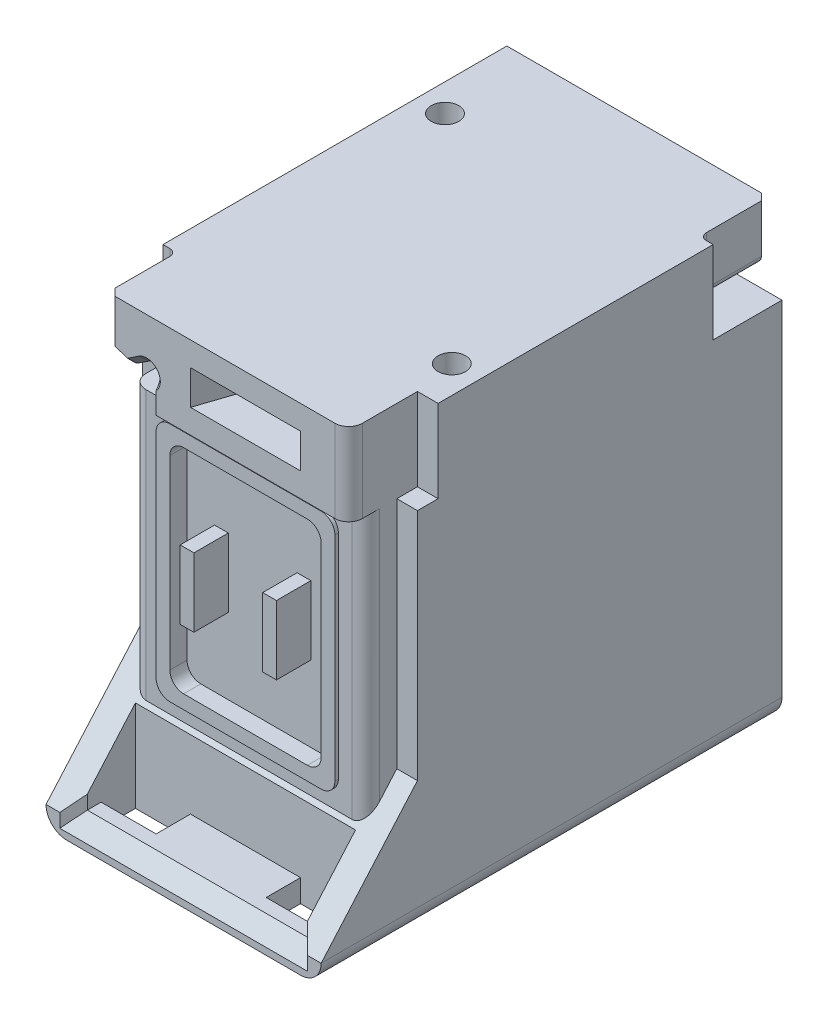
from build123d import *

# Parameters (mm, degrees)
SKETCH1_W           = 10.16
SKETCH1_H           = 16.51
BOSS_EXTRUDE1_DEPTH = 12.7
BOSS_EXTRUDE2_DEPTH = 10.16
SKETCH3_W           = 1.27
SKETCH3_H           = 3.048
CUT_EXTRUDE1_DEPTH  = 1.524
CUT_EXTRUDE2_DEPTH  = 2.54
SKETCH6_W           = 2.032
SKETCH6_H           = 1.27
CUT_EXTRUDE5_DEPTH  = 24.17532524
SKETCH8_W           = 8.128
SKETCH8_H           = 2.032
CUT_EXTRUDE6_DEPTH  = 2.54
CUT_EXTRUDE7_DEPTH  = 8.128
CUT_EXTRUDE8_START  = -1.778
SKETCH10_W          = 8.128
SKETCH10_H          = 0.508
CUT_EXTRUDE8_DEPTH  = 1.778
CUT_EXTRUDE9_DEPTH  = 1.778
BOSS_EXTRUDE3_REACH = 23.113
SKETCH12_W          = 8.636
SKETCH12_H          = 1.143
CUT_EXTRUDE10_DEPTH = 0.508
BOSS_EXTRUDE4_START = 0.127
BOSS_EXTRUDE4_DEPTH = 0.127
SKETCH16_W          = 0.508
SKETCH16_H          = 2.54
BOSS_EXTRUDE5_DEPTH = 1.27
SKETCH18_W          = 7.112
SKETCH18_H          = 3.048
BOSS_EXTRUDE6_DEPTH = 2.54
SKETCH19_W          = 3.048
SKETCH19_H          = 1.27
CUT_EXTRUDE11_DEPTH = 1.524
CUT_EXTRUDE12_DEPTH = 1.524
SKETCH22_R          = 0.508
CUT_EXTRUDE13_DEPTH = 0.762
BOSS_EXTRUDE8_DEPTH = 2.54
FILLET1_R           = 0.762
FILLET2_R           = 0.508
FILLET3_R           = 0.508
FILLET4_R           = 0.254
CHAMFER2_SIZE       = 0.254
FILLET5_R           = 0.254
CHAMFER3_SIZE       = 0.254
FILLET6_R           = 0.254
FILLET8_R           = 0.254


# Some blends are built 0.0001 mm under size
with BuildPart() as part:
    # Sketch1 → Boss-Extrude1 (new body)
    with BuildSketch(Plane.XY):
        with Locations((5.08, 8.255)):
            Rectangle(SKETCH1_W, SKETCH1_H)
    extrude(amount=-BOSS_EXTRUDE1_DEPTH)

    # Sketch2 → Boss-Extrude2 (add)
    with BuildSketch(Plane.ZY):
        Polygon((0, 13.462), (0.762, 13.462), (0.762, 4.826), (4.318, 0.762), (4.318, 0), (0, 0), align=None)
    extrude(amount=-BOSS_EXTRUDE2_DEPTH)

    # Sketch3 → Cut-Extrude1 (cut)
    with BuildSketch(Plane(origin=(0, 0, -12.7), x_dir=(-1, 0, 0), z_dir=(0, 0, -1))):
        with Locations((-1.651, 5.588)):
            Rectangle(SKETCH3_W, SKETCH3_H)
    extrude(amount=-CUT_EXTRUDE1_DEPTH, mode=Mode.SUBTRACT)

    # Sketch4 → Cut-Extrude2 (cut)
    with BuildSketch(Plane(origin=(0, 0, -12.7), x_dir=(-1, 0, 0), z_dir=(0, 0, -1))):
        with BuildLine():
            Line((-10.16, 13.462), (-7.874, 13.462))
            Line((-7.874, 13.462), (-7.874, 14.732))
            ThreePointArc((-7.874, 14.732), (-8.111909378, 14.806021803), (-8.356399754, 14.758016014))
            Line((-8.356399754, 14.758016014), (-9.045285349, 14.432315787))
            ThreePointArc((-9.045285349, 14.432315787), (-9.133273497, 14.40877931), (-9.223907772, 14.41779641))
            Line((-9.223907772, 14.41779641), (-9.468055681, 14.487852091))
            ThreePointArc((-9.468055681, 14.487852091), (-9.600867128, 14.579157177), (-9.652, 14.732))
            Line((-9.652, 14.732), (-9.652, 16.51))
            Line((-9.652, 16.51), (-10.16, 16.51))
            Line((-10.16, 16.51), (-10.16, 13.462))
        make_face()
    extrude(amount=-CUT_EXTRUDE2_DEPTH, mode=Mode.SUBTRACT)

    # Sketch6 → Cut-Extrude5 (cut, through all)
    with BuildSketch(Plane(origin=(0, 0, 0), x_dir=(-1, 0, 0), z_dir=(0, -1, 0))):
        with Locations((-2.032, -2.667)):
            Rectangle(SKETCH6_W, SKETCH6_H)
        with Locations((-8.128, -2.667)):
            Rectangle(SKETCH6_W, SKETCH6_H)
    extrude(amount=-CUT_EXTRUDE5_DEPTH, mode=Mode.SUBTRACT)

    # Sketch8 → Cut-Extrude6 (cut)
    with BuildSketch(Plane.XY.offset(2.032)):
        with Locations((5.08, 2.358571429)):
            Rectangle(SKETCH8_W, SKETCH8_H)
    extrude(amount=CUT_EXTRUDE6_DEPTH, mode=Mode.SUBTRACT)

    # 3DSketch3 → Cut-Extrude7 (cut, along a direction that is not the sketch's normal)
    with BuildSketch(Plane(origin=(0.508, 0.762, 4.318), x_dir=(0.5499719409228688, 0.6285393610547091, -0.5499719409228716), z_dir=(-0.7071067811865493, 0, -0.7071067811865457))):
        Polygon((0, 0), (-0.319297995, 0.395111111), (0.604385491, 0.395111111), (0.923683487, 0), align=None)
    extrude(amount=-CUT_EXTRUDE7_DEPTH, dir=(-1, 0, 0), mode=Mode.SUBTRACT)

    # Sketch10 → Cut-Extrude8 (cut)
    with BuildSketch(Plane.XY.offset(3.81).offset(CUT_EXTRUDE8_START)):
        with Locations((5.08, 1.088571429)):
            Rectangle(SKETCH10_W, SKETCH10_H)
    extrude(amount=CUT_EXTRUDE8_DEPTH, mode=Mode.SUBTRACT)

    # 3DSketch6 → Cut-Extrude9 (cut, along a direction that is not the sketch's normal)
    with BuildSketch(Plane(origin=(9.652, 0.762, 4.318), x_dir=(-0.5499719409228674, 0.6285393610547109, -0.5499719409228712), z_dir=(-0.7071067811865499, 0, 0.7071067811865451))):
        Polygon((0, 0), (0.923683487, 0), (0.604385491, 0.395111111), (-0.319297995, 0.395111111), align=None)
    extrude(amount=CUT_EXTRUDE9_DEPTH, dir=(-1, 0, 0), mode=Mode.SUBTRACT)

    # Boss-Extrude3: up to this plane
    boss_extrude3_end = Plane(origin=(10.16, 0.762, 4.318), z_dir=(0, 0.6585046078685179, 0.752576694706878))
    # Sketch12 → Boss-Extrude3 (add, up to the surface)
    with BuildSketch(Plane(origin=(0, 13.462, 0), x_dir=(1, 0, 0), z_dir=(0, 1, 0)), mode=Mode.PRIVATE) as boss_extrude3_sk1:
        with Locations((5.08, -1.3335)):
            Rectangle(SKETCH12_W, SKETCH12_H)
    boss_extrude3_tool1 = split(extrude(boss_extrude3_sk1.sketch, amount=-BOSS_EXTRUDE3_REACH, mode=Mode.PRIVATE), bisect_by=boss_extrude3_end, keep=Keep.BOTH, mode=Mode.PRIVATE)
    add(boss_extrude3_tool1.solids().sort_by_distance((5.08, 13.462, 1.3335))[0])

    # Sketch13 → Cut-Extrude10 (cut)
    with BuildSketch(Plane.XY.offset(1.905)):
        with BuildLine():
            Line((2.794, 12.427857143), (7.366, 12.427857143))
            ThreePointArc((7.366, 12.427857143), (7.725210245, 12.279067388), (7.874, 11.919857143))
            Line((7.874, 11.919857143), (7.874, 5.061857143))
            ThreePointArc((7.874, 5.061857143), (7.725210245, 4.702646898), (7.366, 4.553857143))
            Line((7.366, 4.553857143), (2.794, 4.553857143))
            ThreePointArc((2.794, 4.553857143), (2.434789755, 4.702646898), (2.286, 5.061857143))
            Line((2.286, 5.061857143), (2.286, 11.919857143))
            ThreePointArc((2.286, 11.919857143), (2.434789755, 12.279067388), (2.794, 12.427857143))
        make_face()
    extrude(amount=-CUT_EXTRUDE10_DEPTH, mode=Mode.SUBTRACT)

    # Sketch14 → Boss-Extrude4 (add)
    with BuildSketch(Plane.XY.offset(1.905).offset(BOSS_EXTRUDE4_START)):
        with BuildLine():
            Line((2.286, 4.045857143), (7.874, 4.045857143))
            ThreePointArc((7.874, 4.045857143), (8.233210245, 4.194646898), (8.382, 4.553857143))
            Line((8.382, 4.553857143), (8.382, 12.427857143))
            ThreePointArc((8.382, 12.427857143), (8.233210245, 12.787067388), (7.874, 12.935857143))
            Line((7.874, 12.935857143), (2.286, 12.935857143))
            ThreePointArc((2.286, 12.935857143), (1.926789755, 12.787067388), (1.778, 12.427857143))
            Line((1.778, 12.427857143), (1.778, 4.553857143))
            ThreePointArc((1.778, 4.553857143), (1.926789755, 4.194646898), (2.286, 4.045857143))
        make_face()
        with BuildLine():
            Line((2.794, 12.427857143), (7.366, 12.427857143))
            ThreePointArc((7.366, 12.427857143), (7.725210245, 12.279067388), (7.874, 11.919857143))
            Line((7.874, 11.919857143), (7.874, 5.061857143))
            ThreePointArc((7.874, 5.061857143), (7.725210245, 4.702646898), (7.366, 4.553857143))
            Line((7.366, 4.553857143), (2.794, 4.553857143))
            ThreePointArc((2.794, 4.553857143), (2.434789755, 4.702646898), (2.286, 5.061857143))
            Line((2.286, 5.061857143), (2.286, 11.919857143))
            ThreePointArc((2.286, 11.919857143), (2.434789755, 12.279067388), (2.794, 12.427857143))
        make_face(mode=Mode.SUBTRACT)
    extrude(amount=-BOSS_EXTRUDE4_DEPTH)

    # Sketch16 → Boss-Extrude5 (add)
    with BuildSketch(Plane.XY.offset(1.397)):
        with Locations((3.556, 8.617857143)):
            Rectangle(SKETCH16_W, SKETCH16_H)
        with Locations((6.604, 8.617857143)):
            Rectangle(SKETCH16_W, SKETCH16_H)
    extrude(amount=BOSS_EXTRUDE5_DEPTH)

    # Sketch18 → Boss-Extrude6 (add)
    with BuildSketch(Plane.XY):
        with Locations((5.842, 14.986)):
            Rectangle(SKETCH18_W, SKETCH18_H)
    extrude(amount=BOSS_EXTRUDE6_DEPTH)

    # Sketch19 → Cut-Extrude11 (cut)
    with BuildSketch(Plane.XY.offset(2.54)):
        with Locations((5.588, 14.986)):
            Rectangle(SKETCH19_W, SKETCH19_H)
    extrude(amount=-CUT_EXTRUDE11_DEPTH, mode=Mode.SUBTRACT)

    # 3DSketch8 → Cut-Extrude12 (cut, along a direction that is not the sketch's normal)
    with BuildSketch(Plane(origin=(4.064, 15.621, 1.016), x_dir=(-0.24806946917841682, -0.6201736729460425, 0.7442084075352507), z_dir=(-0.9486832980505139, 0, -0.31622776601683783))):
        Polygon((0, 0), (1.260192903, 0.996269967), (2.047813468, 0), (0.787620565, -0.996269967), align=None)
    cut_extrude12 = extrude(amount=-CUT_EXTRUDE12_DEPTH, dir=(-1, 0, 0), mode=Mode.SUBTRACT)

    # Mirror1: Cut-Extrude12 across plane
    add(cut_extrude12.mirror(Plane(origin=(5.588, 0, 0), x_dir=(0, 0, 1), z_dir=(1, 0, 0))), mode=Mode.SUBTRACT)

    # Sketch22 → Cut-Extrude13 (cut)
    with BuildSketch(Plane(origin=(0, 16.51, 0), x_dir=(1, 0, 0), z_dir=(0, 1, 0))):
        with Locations(Location((9.144, 1.524, 0), (0, 0, 270))):
            Circle(SKETCH22_R)
        with Locations(Location((1.016, 9.398, 0), (0, 0, 270))):
            Circle(SKETCH22_R)
    extrude(amount=-CUT_EXTRUDE13_DEPTH, mode=Mode.SUBTRACT)

    # Sketch23 → Boss-Extrude8 (add)
    with BuildSketch(Plane.XY):
        with BuildLine():
            Line((2.286, 16.51), (0.508, 16.51))
            Line((0.508, 16.51), (0.508, 14.915072842))
            ThreePointArc((0.508, 14.915072842), (0.555944485, 14.76655643), (0.681678147, 14.674107284))
            Line((0.681678147, 14.674107284), (1.152147648, 14.517284117))
            ThreePointArc((1.152147648, 14.517284117), (1.266183721, 14.506497115), (1.37336335, 14.5469089))
            Line((1.37336335, 14.5469089), (2.032, 14.986))
            Line((2.032, 14.986), (2.286, 14.478))
            Line((2.286, 14.478), (2.286, 16.51))
        make_face()
    extrude(amount=BOSS_EXTRUDE8_DEPTH)

    # Fillet1
    fillet1_edges = [part.edges().sort_by_distance(p)[0] for p in [
        (10.16, 0, -4.191),
        (0, 0, -4.191),
    ]]
    fillet(fillet1_edges, radius=FILLET1_R)

    # Fillet2
    fillet2_edges = [part.edges().sort_by_distance(p)[0] for p in [
        (9.398, 8.490857143, 1.905),
        (0.762, 8.490857143, 1.905),
    ]]
    fillet(fillet2_edges, radius=FILLET2_R)

    # Fillet3
    fillet3_edges = [part.edges().sort_by_distance(p)[0] for p in [
        (9.398, 14.986, 2.54),
    ]]
    fillet(fillet3_edges, radius=FILLET3_R)

    # Fillet4
    fillet4_edges = [part.edges().sort_by_distance(p)[0] for p in [
        (2.032, 14.986, 1.27),
    ]]
    fillet(fillet4_edges, radius=FILLET4_R)

    # Chamfer2
    # the kernel refuses this chamfer: 0.254 mm, written as the material it takes off along each edge
    with BuildSketch(Plane(origin=(1.933490778, 14.615057177, 2.54), x_dir=(-0.512799244946166, -0.8585085523060572, 0), z_dir=(-0.8585085523060572, 0.512799244946166, 0))) as chamfer2_piece_1:
        Polygon((0.254 + CHAMFER2_SIZE, 0), (0.254, -CHAMFER2_SIZE), (0.254, 0), align=None)
    revolve(axis=Axis((1.933490778, 14.615057177, 2.54), (0, 0, 1)), revolution_arc=244.54053411, mode=Mode.SUBTRACT)
    with BuildSketch(Plane(origin=(1.37336335, 14.5469089, 2.54), x_dir=(-0.5547001962252276, 0.8320502943378448, 0), z_dir=(0.8320502943378448, 0.5547001962252276, 0))) as chamfer2_piece_2:
        Polygon((CHAMFER2_SIZE, 0), (0, -CHAMFER2_SIZE), (0, 0), align=None)
    extrude(amount=0.503856054, mode=Mode.SUBTRACT)
    with BuildSketch(Plane(origin=(1.232469501, 14.758249675, 2.54), x_dir=(-0.31622776601683666, -0.9486832980505143, 0), z_dir=(-0.9486832980505143, 0.31622776601683666, 0))) as chamfer2_piece_3:
        Polygon((0.254 - CHAMFER2_SIZE, 0), (0.254, -CHAMFER2_SIZE), (0.254, 0), align=None)
    revolve(axis=Axis((1.232469501, 14.758249675, 2.54), (0, 0, 1)), revolution_arc=52.125016349, mode=Mode.SUBTRACT)
    with BuildSketch(Plane(origin=(0.681678147, 14.674107284, 2.54), x_dir=(0.3162277660168374, 0.948683298050514, 0), z_dir=(0.948683298050514, -0.3162277660168374, 0))) as chamfer2_piece_4:
        Polygon((CHAMFER2_SIZE, 0), (0, -CHAMFER2_SIZE), (0, 0), align=None)
    extrude(amount=0.495918397, mode=Mode.SUBTRACT)
    with BuildSketch(Plane(origin=(0.762, 14.915072842, 2.54), x_dir=(-1, 0, 0), z_dir=(0, 1, 0))) as chamfer2_piece_5:
        Polygon((0.254 - CHAMFER2_SIZE, 0), (0.254, -CHAMFER2_SIZE), (0.254, 0), align=None)
    revolve(axis=Axis((0.762, 14.915072842, 2.54), (0, 0, 1)), revolution_arc=71.565051177, mode=Mode.SUBTRACT)
    with BuildSketch(Plane(origin=(0.508, 17.163207479, 2.54), x_dir=(1, 0, 0), z_dir=(0, -1, 0))) as chamfer2_piece_6:
        Polygon((CHAMFER2_SIZE, 0), (0, -CHAMFER2_SIZE), (0, 0), align=None)
    extrude(amount=2.248134637, mode=Mode.SUBTRACT)

    # Fillet5
    fillet5_edges = [part.edges().sort_by_distance(p)[0] for p in [
        (2.223337642, 14.603324715, 0),
        (1.998684434, 14.860548088, 0),
        (1.582980139, 14.686653426, 0),
        (1.266183721, 14.506497115, 0),
        (0.916912898, 14.595695701, 0),
        (0.555944485, 14.76655643, 0),
        (0.508, 15.712536421, 0),
        (2.286, 13.97, 0),
    ]]
    fillet(fillet5_edges, radius=FILLET5_R)

    # Chamfer3
    chamfer3_edges = [part.edges().sort_by_distance(p)[0] for p in [
        (8.111909378, 14.806021803, -12.7),
        (8.700842551, 14.595165901, -12.7),
        (9.133273497, 14.40877931, -12.7),
        (9.345981727, 14.45282425, -12.7),
        (9.600867128, 14.579157177, -12.7),
        (9.652, 15.621, -12.7),
    ]]
    chamfer(chamfer3_edges, length=CHAMFER3_SIZE - 0.0001)  # a hair under: the kernel refuses the full size

    # Fillet6
    fillet6_edges = [part.edges().sort_by_distance(p)[0] for p in [
        (7.874, 14.732, -11.30305),
    ]]
    fillet(fillet6_edges, radius=FILLET6_R)

    # Fillet8
    fillet8_edges = [part.edges().sort_by_distance(p)[0] for p in [
        (9.652, 15.621, -10.16),
        (9.600867128, 14.579157177, -10.16),
        (9.345981727, 14.45282425, -10.16),
        (9.133273497, 14.40877931, -10.16),
        (8.239512108, 14.796769766, -10.16),
        (8.700842551, 14.595165901, -10.16),
        (7.944454866, 14.728085686, -10.16),
        (7.874, 14.007254484, -10.16),
    ]]
    fillet(fillet8_edges, radius=FILLET8_R)


solid = part.part
